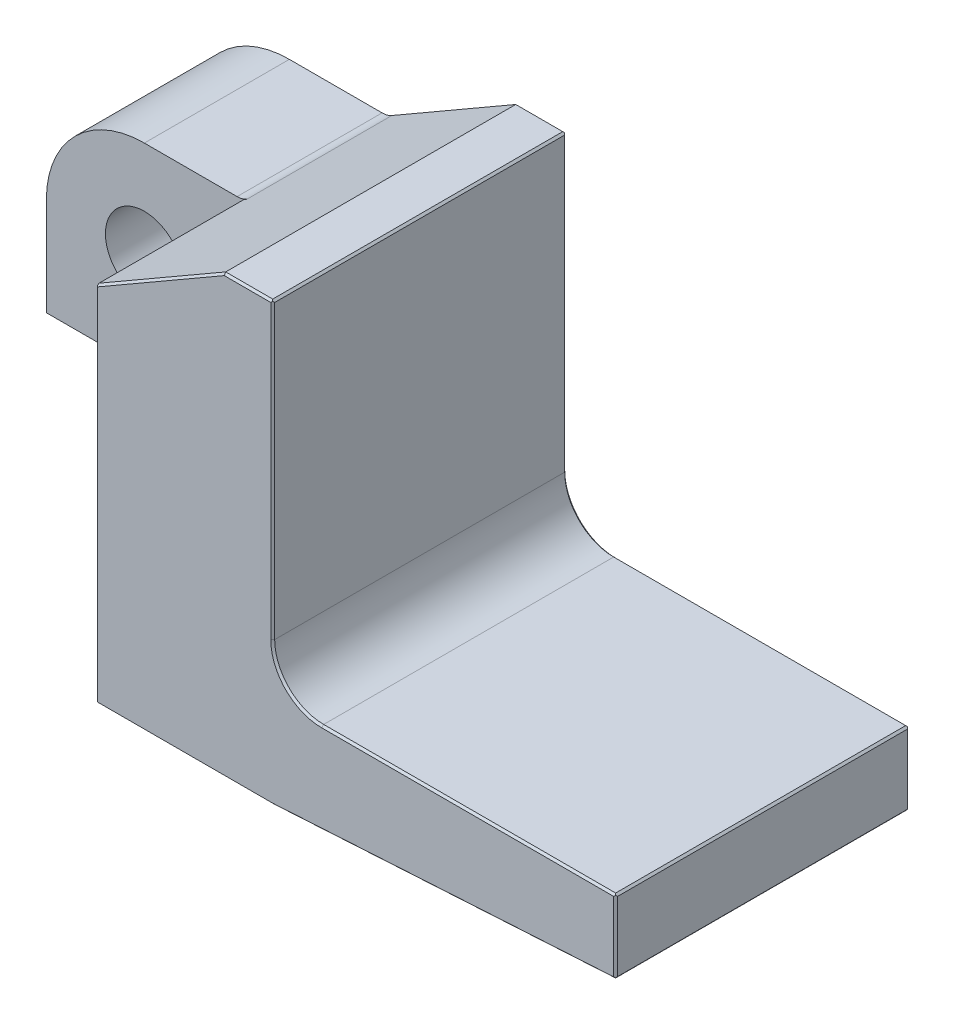
from build123d import *
from OCP.BRepFilletAPI import BRepFilletAPI_MakeChamfer

# Parameters (mm, degrees)
BOSS_EXTRUDE1_DEPTH                                  = 38.1
FILLET2_R                                            = 6.35
CUT_EXTRUDE1_START                                   = -19.05
CUT_EXTRUDE1_DEPTH                                   = 19.05
FILLET3_R                                            = 2.54
CBORE_FOR_3_8_BINDING_HEAD_MACHINE_SCREW_D           = 10.0838
CBORE_FOR_3_8_BINDING_HEAD_MACHINE_SCREW_CBORE_D     = 20.828
CBORE_FOR_3_8_BINDING_HEAD_MACHINE_SCREW_CBORE_DEPTH = 6.4262
CHAMFER3_SIZE                                        = 0.254
CHAMFER5_SIZE                                        = 0.254
CHAMFER5_SIZE2                                       = 0.270375256


with BuildPart() as part:
    # Sketch1 → Boss-Extrude1 (new body)
    with BuildSketch(Plane.XY):
        with BuildLine():
            Line((0, 0), (44.45, 0))
            Line((44.45, 0), (44.45, -9.525))
            Line((44.45, -9.525), (0, -12.1446544))
            Line((0, -12.1446544), (-22.9902, -12.1446544))
            Line((-22.9902, -12.1446544), (-22.9902, 9.4453456))
            Line((-22.9902, 9.4453456), (-48.3902, 9.4453456))
            Line((-48.3902, 9.4453456), (-48.3902, 22.1453456))
            ThreePointArc((-48.3902, 22.1453456), (-44.670456121, 31.125601721), (-35.6902, 34.8453456))
            Line((-35.6902, 34.8453456), (-22.9902, 34.8453456))
            Line((-22.9902, 34.8453456), (-6.35, 44.45))
            Line((-6.35, 44.45), (0, 44.45))
            Line((0, 44.45), (0, 0))
        make_face()
    extrude(amount=BOSS_EXTRUDE1_DEPTH)

    # Fillet2
    fillet2_edges = [part.edges().sort_by_distance(p)[0] for p in [
        (0, 0, 19.05),
    ]]
    fillet(fillet2_edges, radius=FILLET2_R)

    # Sketch3 → Cut-Extrude1 (cut)
    with BuildSketch(Plane.XY.offset(38.1).offset(CUT_EXTRUDE1_START)):
        with BuildLine():
            Line((-48.3902, 9.4453456), (-22.9902, 9.4453456))
            Line((-22.9902, 9.4453456), (-22.9902, 34.8453456))
            Line((-22.9902, 34.8453456), (-35.6902, 34.8453456))
            ThreePointArc((-35.6902, 34.8453456), (-44.670456121, 31.125601721), (-48.3902, 22.1453456))
            Line((-48.3902, 22.1453456), (-48.3902, 9.4453456))
        make_face()
    extrude(amount=CUT_EXTRUDE1_DEPTH, mode=Mode.SUBTRACT)

    # Fillet3
    fillet3_edges = [part.edges().sort_by_distance(p)[0] for p in [
        (-22.9902, 34.8453456, 9.525),
    ]]
    fillet(fillet3_edges, radius=FILLET3_R)

    # CBORE for 3/8 Binding Head Machine Screw1 (through all)
    with Locations(Plane(origin=(0, 0, 0), x_dir=(-1, 0, 0), z_dir=(0, 0, -1))):
        with Locations((35.6902, 22.1453456)):
            CounterBoreHole(CBORE_FOR_3_8_BINDING_HEAD_MACHINE_SCREW_D / 2, CBORE_FOR_3_8_BINDING_HEAD_MACHINE_SCREW_CBORE_D / 2, CBORE_FOR_3_8_BINDING_HEAD_MACHINE_SCREW_CBORE_DEPTH)

    # Chamfer3
    chamfer3_edges = [part.edges().sort_by_distance(p)[0] for p in [
        (25.4, 0, 0),
        (44.45, 0, 19.05),
        (0, 44.45, 19.05),
        (0, 25.4, 0),
        (0, 25.4, 38.1),
        (1.859871939, 1.859871939, 0),
        (1.859871939, 1.859871939, 38.1),
        (25.4, 0, 38.1),
    ]]
    chamfer(chamfer3_edges, length=CHAMFER3_SIZE)

    # Chamfer5: one chamfer whose edges measure the first distance from different faces: ONE call of the kernel's chamfer builder (chamfer() names one face for all edges)
    chamfer5_edges_1 = [part.edges().sort_by_distance(p)[0] for p in [
        (44.45, -4.8895, 0),
        (-14.6701, 39.6476728, 38.1),
        (-48.3902, 15.7953456, 0),
        (-44.670456121, 31.125601721, 0),
        (-14.375444039, 39.817746998, 0),
        (44.45, -4.8895, 38.1),
        (-29.680416649, 34.8453456, 0),
        (-23.013375005, 34.931855935, 0),
        (-3.302, 44.45, 38.1),
        (-3.302, 44.45, 0),
    ]]
    chamfer5_edges_2 = [part.edges().sort_by_distance(p)[0] for p in [
        (44.45, -9.525, 19.05),
    ]]
    chamfer5_side_2 = [part.faces().sort_by_distance(p)[0] for p in [
        (22.225, -10.8348272, 19.05),
    ]]
    chamfer5 = BRepFilletAPI_MakeChamfer(part.part.solid().wrapped)
    for e in chamfer5_edges_1:
        chamfer5.Add(CHAMFER5_SIZE, e.wrapped)
    for e in chamfer5_edges_2:
        chamfer5.Add(CHAMFER5_SIZE, CHAMFER5_SIZE2, e.wrapped, chamfer5_side_2[0].wrapped)  # the first distance lies on this face
    add(Compound.cast(chamfer5.Shape()), mode=Mode.REPLACE)

    # Chamfer6
    # the kernel refuses this chamfer: 0.693641083, 0.254 mm, written as the material it takes off along each edge
    with BuildSketch(Plane(origin=(-22.820866667, -11.975321067, 0.169333333), x_dir=(0, -0.7071067811865468, 0.7071067811865481), z_dir=(-0.5773502691896234, -0.5773502691896274, -0.5773502691896264))) as chamfer6_piece_1:
        Polygon((-0.179605122, -0.103695066), (0.179605122, -0.103695066), (0, 0.207390132), align=None)
    extrude(amount=0.32262333, mode=Mode.SUBTRACT)
    with BuildSketch(Plane(origin=(-22.820866667, -11.975321067, 37.930666667), x_dir=(0, -0.70710678118655, -0.707106781186545), z_dir=(-0.5773502691896217, -0.5773502691896258, 0.5773502691896298))) as chamfer6_piece_2:
        Polygon((-0.179605122, 0.103695066), (0.179605122, 0.103695066), (0, -0.207390132), align=None)
    extrude(amount=0.32262333, mode=Mode.SUBTRACT)
    with BuildSketch(Plane(origin=(-22.9902, 34.8453456, 19.05), x_dir=(-0.009971465906807519, -0.9999502836979793, 0), z_dir=(0, 0, 1))) as chamfer6_piece_3:
        with BuildLine():
            Line((0.720476303, 0), (-0.15603149, 0.22562472))
            Line((-0.15603149, 0.22562472), (-0.16797676, 0.218570238))
            ThreePointArc((-0.16797676, 0.218570238), (-0.081514433, 0.11074615), (-0.01194527, -0.007054482))
            Line((-0.01194527, -0.007054482), (0.000138332, -0.013872132))
            ThreePointArc((0.000138332, -0.013872132), (0.360340666, -0.010280208), (0.720614636, -0.013872132))
            Line((0.720614636, -0.013872132), (0.720476303, 0))
        make_face()
    extrude(amount=20.597190759, mode=Mode.SUBTRACT)
    with BuildSketch(Plane(origin=(-22.9902, -12.797861879, 0), x_dir=(0.9996219169112968, 0, -0.027495876610586136), z_dir=(0, 1, 0))) as chamfer6_piece_4:
        with BuildLine():
            Line((0.261282992, 0), (-0.014362977, -0.26088792))
            Line((-0.014362977, -0.26088792), (-0.019441057, -0.260748241))
            ThreePointArc((-0.019441057, -0.260748241), (-0.008668824, -0.130403049), (-0.005078079, 0.000139679))
            Line((-0.005078079, 0.000139679), (0.000139679, 0.005078079))
            ThreePointArc((0.000139679, 0.005078079), (0.130682407, 0.001487335), (0.261422671, 0.005078079))
            Line((0.261422671, 0.005078079), (0.261282992, 0))
        make_face()
    extrude(amount=22.243207479, mode=Mode.SUBTRACT)
    with BuildSketch(Plane(origin=(44.848076027, -9.501539446, 0), x_dir=(-0.058810529584687465, 0.9978904240343144, -0.027495876610586504), z_dir=(-0.9982678522272378, -0.05883277326131908, 0)), Plane(origin=(44.848076027, -9.501539446, 38.1), x_dir=(0.0016176586742518812, -0.02744824968915599, -0.9996219169112968), z_dir=(-0.9982678522272378, -0.05883277326131908, 0))) as chamfer6_piece_5:
        with BuildLine():
            Line((0.261282992, 0), (-0.014362977, -0.26088792))
            Line((-0.014362977, -0.26088792), (-0.019441057, -0.260748241))
            ThreePointArc((-0.019441057, -0.260748241), (-0.008668824, -0.130403049), (-0.005078079, 0.000139679))
            Line((-0.005078079, 0.000139679), (0.000139679, 0.005078079))
            ThreePointArc((0.000139679, 0.005078079), (0.130682407, 0.001487335), (0.261422671, 0.005078079))
            Line((0.261422671, 0.005078079), (0.261282992, 0))
        make_face()
    extrude(amount=45.579101794, mode=Mode.SUBTRACT)
    with BuildSketch(Plane(origin=(0.653207479, -12.1446544, 0), x_dir=(0, 0.9996219169112968, -0.0274958766105868), z_dir=(-1, 0, 0)), Plane(origin=(0.653207479, -12.1446544, 38.1), x_dir=(0, -0.027495876610587867, -0.9996219169112968), z_dir=(-1, 0, 0))) as chamfer6_piece_6:
        with BuildLine():
            Line((0.261282992, 0), (-0.014362977, -0.26088792))
            Line((-0.014362977, -0.26088792), (-0.019441057, -0.260748241))
            ThreePointArc((-0.019441057, -0.260748241), (-0.008668824, -0.130403049), (-0.005078079, 0.000139679))
            Line((-0.005078079, 0.000139679), (0.000139679, 0.005078079))
            ThreePointArc((0.000139679, 0.005078079), (0.130682407, 0.001487335), (0.261422671, 0.005078079))
            Line((0.261422671, 0.005078079), (0.261282992, 0))
        make_face()
    extrude(amount=24.296614958, mode=Mode.SUBTRACT)
    with BuildSketch(Plane(origin=(-22.9902, -12.1446544, -0.653207479), x_dir=(0.9996219169112968, -0.027495876610587118, 0), z_dir=(0, 0, 1))) as chamfer6_piece_7:
        with BuildLine():
            Line((0.261282992, 0), (-0.014362977, 0.26088792))
            Line((-0.014362977, 0.26088792), (-0.019441057, 0.260748241))
            ThreePointArc((-0.019441057, 0.260748241), (-0.008668824, 0.130403049), (-0.005078079, -0.000139679))
            Line((-0.005078079, -0.000139679), (0.000139679, -0.005078079))
            ThreePointArc((0.000139679, -0.005078079), (0.130682407, -0.001487335), (0.261422671, -0.005078079))
            Line((0.261422671, -0.005078079), (0.261282992, 0))
        make_face()
    extrude(amount=39.406414958, mode=Mode.SUBTRACT)
    with BuildSketch(Plane(origin=(-22.9902, 35.205278751, 38.1), x_dir=(-0.027495876610587867, 0, -0.9996219169112968), z_dir=(0, -1, 0))) as chamfer6_piece_8:
        with BuildLine():
            Line((0.261282992, 0), (-0.014362977, 0.26088792))
            Line((-0.014362977, 0.26088792), (-0.019441057, 0.260748241))
            ThreePointArc((-0.019441057, 0.260748241), (-0.008668824, 0.130403049), (-0.005078079, -0.000139679))
            Line((-0.005078079, -0.000139679), (0.000139679, -0.005078079))
            ThreePointArc((0.000139679, -0.005078079), (0.130682407, -0.001487335), (0.261422671, -0.005078079))
            Line((0.261422671, -0.005078079), (0.261282992, 0))
        make_face()
    extrude(amount=48.00314063, mode=Mode.SUBTRACT)


solid = part.part
